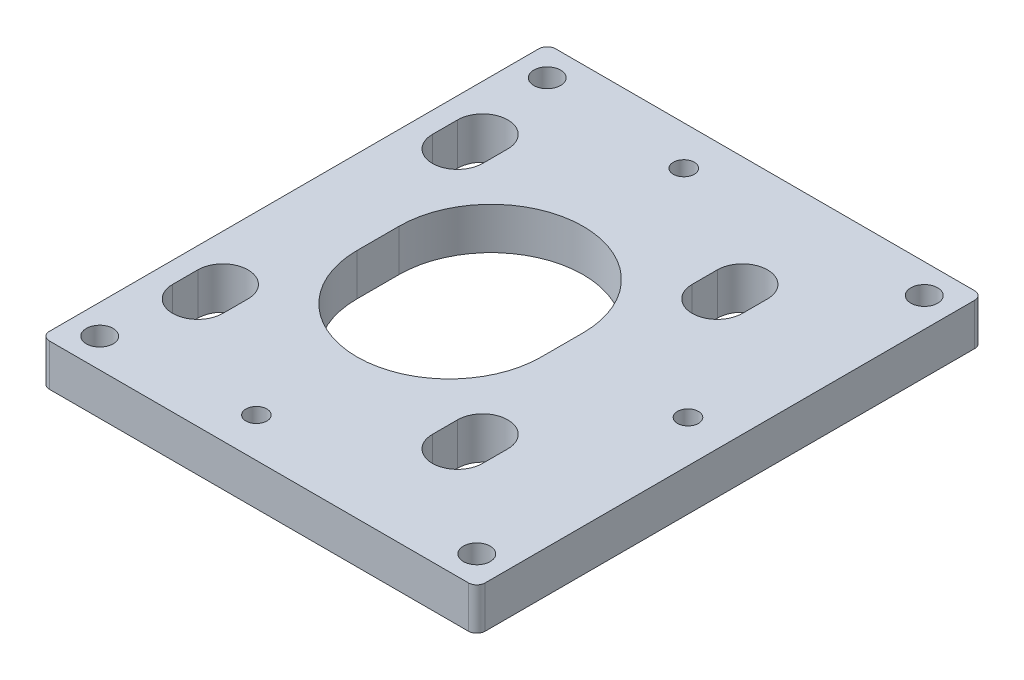
from build123d import *

# Parameters (mm, degrees)
SKETCH1_W                   = 52
SKETCH1_H                   = 60.4
BOSS_EXTRUDE1_DEPTH         = 5
M3_CLEARANCE_HOLE1_D        = 3.2
FILLET1_R                   = 1
TAP_DRILL_FOR_M3X0_5_TAP1_D = 2.5


with BuildPart() as part:
    # Sketch1 → Boss-Extrude1 (new body)
    with BuildSketch(Plane(origin=(0, 0, 0), x_dir=(1, 0, 0), z_dir=(0, 1, 0))):
        with Locations((5, 0)):
            Rectangle(SKETCH1_W, SKETCH1_H)
        with BuildLine():
            Line((-11, -2.5), (-11, 2.5))
            ThreePointArc((-11, 2.5), (0, 13.5), (11, 2.5))
            Line((11, 2.5), (11, -2.5))
            ThreePointArc((11, -2.5), (0, -13.5), (-11, -2.5))
        make_face(mode=Mode.SUBTRACT)
        with BuildLine():
            Line((-18.5, 14), (-18.5, 17))
            ThreePointArc((-18.5, 17), (-15.5, 20), (-12.5, 17))
            Line((-12.5, 17), (-12.5, 14))
            ThreePointArc((-12.5, 14), (-15.5, 11), (-18.5, 14))
        make_face(mode=Mode.SUBTRACT)
        with BuildLine():
            Line((12.5, 14), (12.5, 17))
            ThreePointArc((12.5, 17), (15.5, 20), (18.5, 17))
            Line((18.5, 17), (18.5, 14))
            ThreePointArc((18.5, 14), (15.5, 11), (12.5, 14))
        make_face(mode=Mode.SUBTRACT)
        with BuildLine():
            Line((12.5, -17), (12.5, -14))
            ThreePointArc((12.5, -14), (15.5, -11), (18.5, -14))
            Line((18.5, -14), (18.5, -17))
            ThreePointArc((18.5, -17), (15.5, -20), (12.5, -17))
        make_face(mode=Mode.SUBTRACT)
        with BuildLine():
            Line((-18.5, -17), (-18.5, -14))
            ThreePointArc((-18.5, -14), (-15.5, -11), (-12.5, -14))
            Line((-12.5, -14), (-12.5, -17))
            ThreePointArc((-12.5, -17), (-15.5, -20), (-18.5, -17))
        make_face(mode=Mode.SUBTRACT)
    extrude(amount=BOSS_EXTRUDE1_DEPTH)

    # M3 Clearance Hole1 (through all)
    with Locations(Plane(origin=(0, 5, 0), x_dir=(1, 0, 0), z_dir=(0, 1, 0))):
        with Locations((-17.5, -26.7), (27.5, -26.7), (27.5, 26.7), (-17.5, 26.7)):
            Hole(M3_CLEARANCE_HOLE1_D / 2)

    # Fillet1
    fillet1_edges = [part.edges().sort_by_distance(p)[0] for p in [
        (31, 2.5, -30.2),
        (-21, 2.5, -30.2),
        (31, 2.5, 30.2),
        (-21, 2.5, 30.2),
    ]]
    fillet(fillet1_edges, radius=FILLET1_R)

    # Tap Drill for M3x0.5 Tap1 (through all)
    with Locations(Plane(origin=(0, 5, 0), x_dir=(1, 0, 0), z_dir=(0, 1, 0))):
        with Locations((26, 0), (0, 25.5), (0, -25.5)):
            Hole(TAP_DRILL_FOR_M3X0_5_TAP1_D / 2)


solid = part.part
